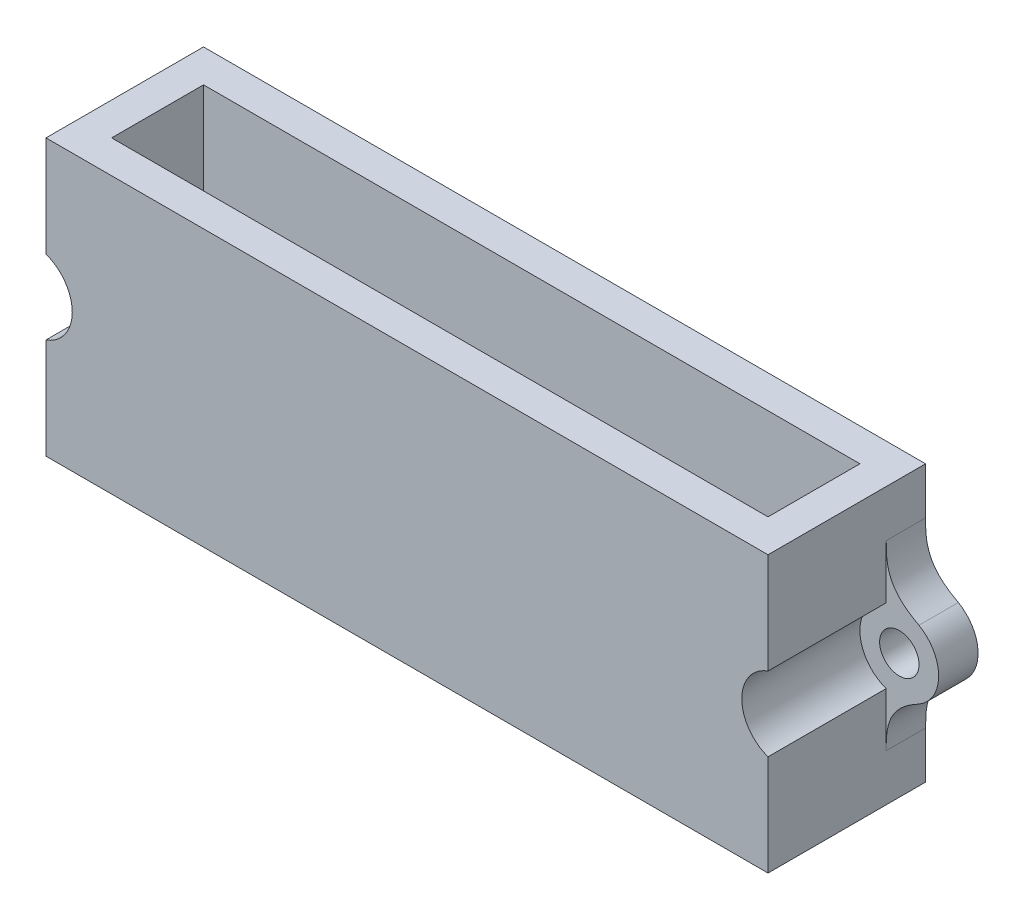
from build123d import *

# Parameters (mm, degrees)
SKETCH1_W               = 55
SKETCH1_H               = 21
BOSS_EXTRUDE1_DEPTH     = 12
SHELL1_T                = -2.5
SKETCH2_R               = 3
BOSS_EXTRUDE2_DEPTH     = 3
CUT_EXTRUDE1_DEPTH      = 30
CUT_EXTRUDE1_DEPTH_BACK = 5
SKETCH3_R               = 1.5
CUT_EXTRUDE5_START      = -9
SKETCH4_R               = 3
CUT_EXTRUDE5_DEPTH      = 9
FILLET1_DEPTH           = 3


with BuildPart() as part:
    # Sketch1 → Boss-Extrude1 (new body)
    with BuildSketch(Plane.XY):
        Rectangle(SKETCH1_W, SKETCH1_H)
    extrude(amount=BOSS_EXTRUDE1_DEPTH)

    # Shell1
    shell1_openings = [part.faces().sort_by_distance(p)[0] for p in [
        (0, 10.5, 6),
    ]]
    offset(amount=SHELL1_T, openings=shell1_openings, kind=Kind.INTERSECTION)

    # Sketch2 → Boss-Extrude2 (add)
    with BuildSketch(Plane(origin=(0, 0, 0), x_dir=(-1, 0, 0), z_dir=(0, 0, -1))):
        with Locations((28.5, 0)):
            Circle(SKETCH2_R)
        with Locations((-28.5, 0)):
            Circle(SKETCH2_R)
    extrude(amount=-BOSS_EXTRUDE2_DEPTH)

    # Sketch3 → Cut-Extrude1 (cut, two sides: drawn at the far end of the back side and taken through both)
    with BuildSketch(Plane.XY.offset(3).offset(-CUT_EXTRUDE1_DEPTH_BACK)):
        with Locations(Location((-28.5, 0, 0), (0, 0, 48.189685104))):
            Circle(SKETCH3_R)
        with Locations(Location((28.5, 0, 0), (0, 0, 131.810314896))):
            Circle(SKETCH3_R)
    extrude(amount=CUT_EXTRUDE1_DEPTH + CUT_EXTRUDE1_DEPTH_BACK, mode=Mode.SUBTRACT)

    # Sketch4 → Cut-Extrude5 (cut)
    with BuildSketch(Plane.XY.offset(12).offset(CUT_EXTRUDE5_START)):
        with Locations((-28.5, 0)):
            Circle(SKETCH4_R)
        with Locations((28.5, 0)):
            Circle(SKETCH4_R)
    extrude(amount=CUT_EXTRUDE5_DEPTH, mode=Mode.SUBTRACT)

    # Fillet1: read off the stored shape, not the designer's step
    # Fillet1 outline → Fillet1 (add)
    with BuildSketch(Plane.XY):
        with BuildLine():
            add(Edge.make_bspline(
                [(30, -2.598076211), (29.735280722, -2.750911958), (29.325654839, -2.942455607), (28.108593688, -3.775872627), (27.622600662, -4.829914939), (27.5, -5.892304845), (27.5, -6.410254038), (27.5, -6.92820323)],
                knots=[0, 0, 0, 0, 0, 0, 0.5, 0.5, 1, 1, 1, 1, 1, 1], degree=5))
            ThreePointArc((30, -2.598076211), (28.775255129, -2.987345748), (27.5, -2.828427125))
            Line((27.5, -2.828427125), (27.5, -6.92820323))
        make_face()
        with BuildLine():
            add(Edge.make_bspline(
                [(27.5, 6.92820323), (27.5, 6.410254038), (27.5, 5.892304845), (27.622600662, 4.829914939), (28.108593688, 3.775872627), (29.325654839, 2.942455607), (29.735280722, 2.750911958), (30, 2.598076211)],
                knots=[0, 0, 0, 0, 0, 0, 0.5, 0.5, 1, 1, 1, 1, 1, 1], degree=5))
            Line((27.5, 6.92820323), (27.5, 2.828427125))
            ThreePointArc((27.5, 2.828427125), (28.775255129, 2.987345748), (30, 2.598076211))
        make_face()
        with BuildLine():
            add(Edge.make_bspline(
                [(-30, 2.598076211), (-29.735280722, 2.750911958), (-29.325654839, 2.942455607), (-28.108593688, 3.775872627), (-27.622600662, 4.829914939), (-27.5, 5.892304845), (-27.5, 6.410254038), (-27.5, 6.92820323)],
                knots=[0, 0, 0, 0, 0, 0, 0.5, 0.5, 1, 1, 1, 1, 1, 1], degree=5))
            ThreePointArc((-30, 2.598076211), (-28.775255129, 2.987345748), (-27.5, 2.828427125))
            Line((-27.5, 2.828427125), (-27.5, 6.92820323))
        make_face()
        with BuildLine():
            add(Edge.make_bspline(
                [(-27.5, -6.92820323), (-27.5, -6.410254038), (-27.5, -5.892304845), (-27.622600662, -4.829914939), (-28.108593688, -3.775872627), (-29.325654839, -2.942455607), (-29.735280722, -2.750911958), (-30, -2.598076211)],
                knots=[0, 0, 0, 0, 0, 0, 0.5, 0.5, 1, 1, 1, 1, 1, 1], degree=5))
            Line((-27.5, -6.92820323), (-27.5, -2.828427125))
            ThreePointArc((-27.5, -2.828427125), (-28.775255129, -2.987345748), (-30, -2.598076211))
        make_face()
    extrude(amount=FILLET1_DEPTH)


solid = part.part
